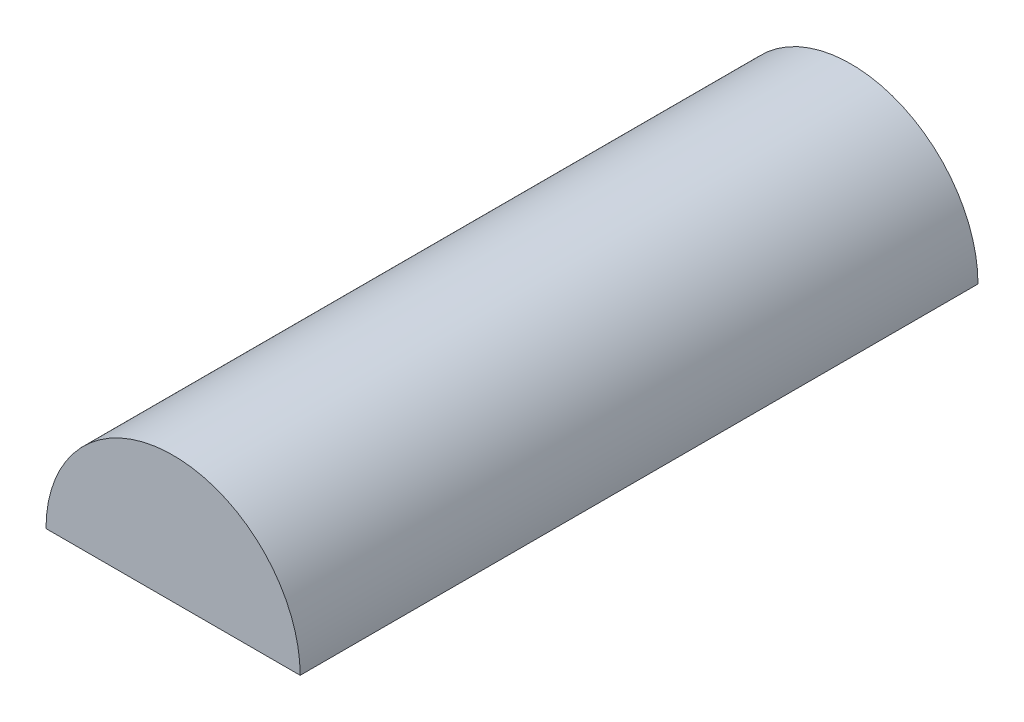
from build123d import *

# Parameters (mm, degrees)
BOSS_EXTRUDE1_DEPTH = 406.4
SHELL1_T            = -6.35


with BuildPart() as part:
    # Sketch1 → Boss-Extrude1 (new body)
    with BuildSketch(Plane.XY):
        with BuildLine():
            Line((-76.2, 0), (76.2, 0))
            ThreePointArc((76.2, 0), (0, 76.2), (-76.2, 0))
        make_face()
    extrude(amount=BOSS_EXTRUDE1_DEPTH)

    # Shell1
    shell1_openings = [part.faces().sort_by_distance(p)[0] for p in [
        (0, 0, 203.2),
    ]]
    offset(amount=SHELL1_T, openings=shell1_openings)


solid = part.part
